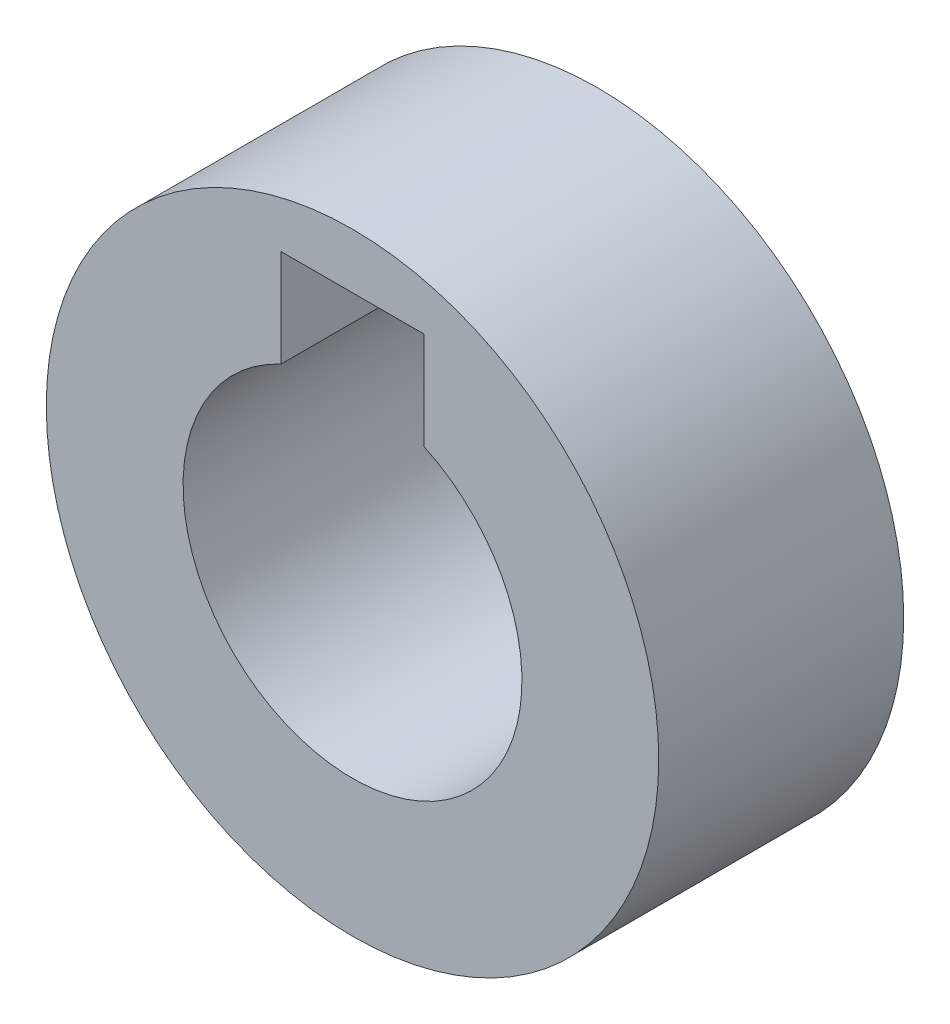
from build123d import *

# Parameters (mm, degrees)
SKIZZE1_R                       = 7.5
AUFSATZ_LINEAR_AUSTRAGEN1_DEPTH = 6


with BuildPart() as part:
    # Skizze1 → Aufsatz-Linear austragen1 (new body)
    with BuildSketch(Plane.XY):
        Circle(SKIZZE1_R)
        with BuildLine():
            ThreePointArc((4.15, 0), (-2.23159136, -3.498928407), (-1.75, 3.762977544))
            Line((-1.75, 3.762977544), (-1.75, 6.15))
            Line((-1.75, 6.15), (1.75, 6.15))
            Line((1.75, 6.15), (1.75, 3.762977544))
            ThreePointArc((1.75, 3.762977544), (3.498928407, 2.23159136), (4.15, 0))
        make_face(mode=Mode.SUBTRACT)
    extrude(amount=AUFSATZ_LINEAR_AUSTRAGEN1_DEPTH)


solid = part.part
